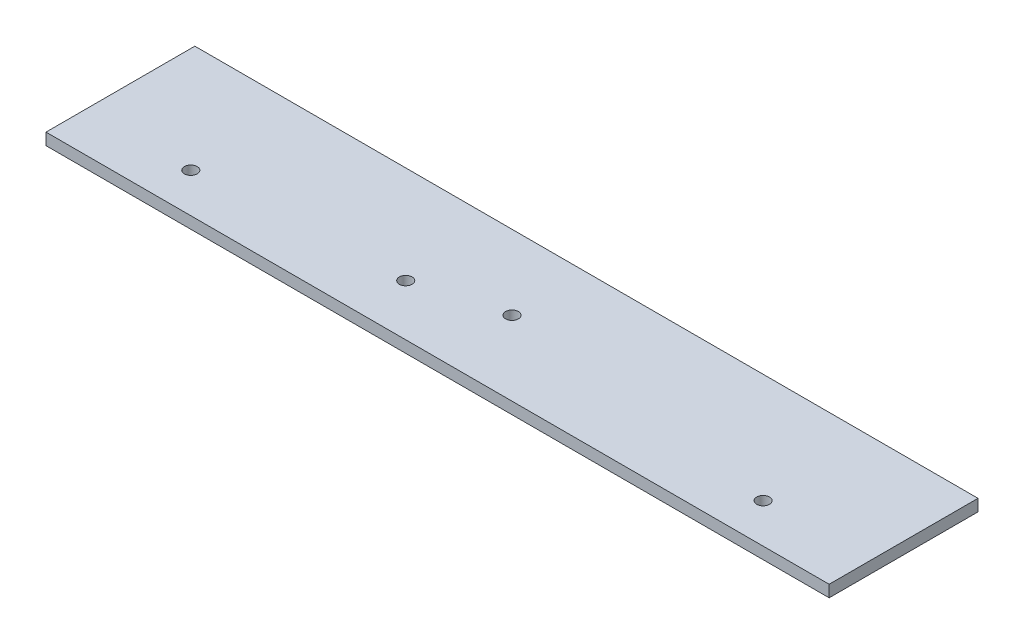
from build123d import *

# Parameters (mm, degrees)
SKETCH1_W           = 194.300874916
SKETCH1_H           = 36.931173376
SKETCH1_R           = 1.5875
BOSS_EXTRUDE1_DEPTH = 1.4605


with BuildPart() as part:
    # Sketch1 → Boss-Extrude1 (new, symmetric)
    with BuildSketch(Plane(origin=(0, 0, 0), x_dir=(1, 0, 0), z_dir=(0, 1, 0))):
        Rectangle(SKETCH1_W, SKETCH1_H)
        with Locations((-71, -8.695)):
            Circle(SKETCH1_R, mode=Mode.SUBTRACT)
        with Locations((71, -8.695)):
            Circle(SKETCH1_R, mode=Mode.SUBTRACT)
        Circle(SKETCH1_R, mode=Mode.SUBTRACT)
        with Locations((-20.62, -5.75)):
            Circle(SKETCH1_R, mode=Mode.SUBTRACT)
    extrude(amount=BOSS_EXTRUDE1_DEPTH, both=True)


solid = part.part
